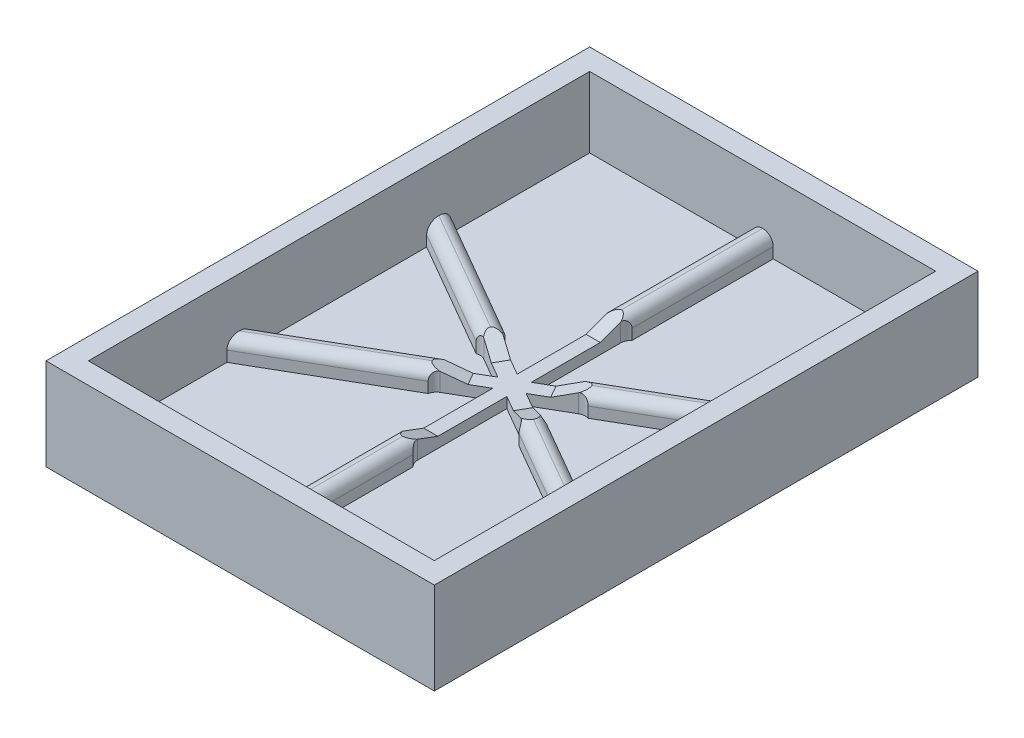
from build123d import *

# Parameters (mm, degrees)
ESQUISSE1_W        = 55
ESQUISSE1_H        = 77
BOSS_EXTRU_1_DEPTH = 3
ESQUISSE2_W        = 55
ESQUISSE2_H        = 77
BOSS_EXTRU_2_DEPTH = 10
BOSS_EXTRU_5_DEPTH = 1.5
BOSS_EXTRU_6_DEPTH = 3
BOSS_EXTRU_7_DEPTH = 2
BOSS_EXTRU_8_DEPTH = 2
BOSS_EXTRU_9_DEPTH = 2
CONG_3_R           = 1.5
CONG_4_R           = 1.5


# Some blends are built 0.0001 mm under size
with BuildPart() as part:
    # Esquisse1 → Boss.-Extru.1 (new body)
    with BuildSketch(Plane(origin=(0, 0, 0), x_dir=(1, 0, 0), z_dir=(0, 1, 0))):
        Rectangle(ESQUISSE1_W, ESQUISSE1_H)
    extrude(amount=BOSS_EXTRU_1_DEPTH)

    # Esquisse2 → Boss.-Extru.2 (add)
    with BuildSketch(Plane(origin=(0, 3, 0), x_dir=(1, 0, 0), z_dir=(0, 1, 0))):
        Rectangle(ESQUISSE2_W, ESQUISSE2_H)
        Polygon((-24.499999999999993, 35.50000000000001), (-24.499999999999982, -35.49999999999999), (24.500000000000007, -35.49999999999999), (24.499999999999993, 35.50000000000001), align=None, mode=Mode.SUBTRACT)
    extrude(amount=BOSS_EXTRU_2_DEPTH)

    # Esquisse3 → Boss.-Extru.5 (add)
    with BuildSketch(Plane(origin=(0, 3, 0), x_dir=(1, 0, 0), z_dir=(0, 1, 0))):
        Polygon((-1.0000000000000002, -35.500000000000014), (-1.000000000000001, -1.7320508075692145), (-25.4807621135329, -15.866025403784949), (-26.480762113533657, -14.133974596214742), (-2.000000000001547, 2.4e-16), (-26.480762113533604, 14.133974596214733), (-25.48076211353285, 15.866025403784942), (-1.0000000000003295, 1.7320508075699388), (-1.0000000000000002, 35.5), (0.9999999999999998, 35.5), (1.0000000000000004, 1.73205080756975), (25.48076211353284, 15.866025403784917), (26.4807621135336, 14.133974596214713), (2.0000000000011395, 2.3766e-13), (26.480762113533643, -14.133974596214754), (25.480762113532894, -15.86602540378496), (1.0000000000000002, -1.732050807569746), (0.9999999999999998, -35.500000000000014), align=None)
    extrude(amount=BOSS_EXTRU_5_DEPTH)

    # Esquisse4 → Boss.-Extru.6 (add)
    with BuildSketch(Plane(origin=(0, 3, 0), x_dir=(1, 0, 0), z_dir=(0, 1, 0))):
        Polygon((-7.929491924311156, -2.8460434894690736), (-26.335106973446237, -13.472530292687704), (-24.835106973446255, -16.070606504041027), (-6.429491924311169, -5.444119700822397), align=None)
        Polygon((1.4999999999999996, 35.50000000000001), (1.5000000000000027, 15.500000000000004), (-1.4999999999999978, 15.500000000000004), (-1.4999999999999996, 35.50000000000001), align=None)
        Polygon((-7.929491924311157, 2.846043489469073), (-6.429491924311172, 5.444119700822394), (-24.835106973446262, 16.070606504041017), (-26.33510697344624, 13.472530292687692), align=None)
        Polygon((7.929491924311156, 2.8460434894690683), (6.429491924311175, 5.44411970082239), (24.835106973446265, 16.070606504041002), (26.335106973446248, 13.47253029268768), align=None)
        Polygon((6.429491924311165, -5.444119700822401), (24.835106973446248, -16.07060650404104), (26.33510697344623, -13.472530292687718), (7.929491924311156, -2.846043489469078), align=None)
        Polygon((1.5000000000000113, -15.500000000000004), (-1.4999999999999891, -15.500000000000004), (-1.4999999999999796, -35.50000000000001), (1.5000000000000195, -35.50000000000001), align=None)
    extrude(amount=BOSS_EXTRU_6_DEPTH)

    # Esquisse5 → Boss.-Extru.7 (add)
    with BuildSketch(Plane(origin=(1.0000000000000004, 0, -2e-17), x_dir=(-2e-17, 0, -1), z_dir=(1, 0, -2e-17))):
        Polygon((15.500000000000004, 4.500000000000001), (15.500000000000004, 6), (11.500000000000004, 4.500000000000001), align=None)
        Polygon((-15.500000000000004, 4.500000000000001), (-15.500000000000004, 6), (-11.500000000000004, 4.500000000000001), align=None)
    extrude(amount=-BOSS_EXTRU_7_DEPTH)

    # Esquisse6 → Boss.-Extru.8 (add)
    with BuildSketch(Plane(origin=(0.5000000000003775, 0, -0.8660254037851042), x_dir=(-0.8660254037844415, 0, -0.4999999999999951), z_dir=(0.4999999999999951, 0, -0.8660254037844415))):
        Polygon((8.29016319029156, 4.500000000000001), (8.29016319029156, 6), (4.29016319029156, 4.500000000000001), align=None)
        Polygon((-8.290163190291564, 4.500000000000001), (-8.290163190291564, 6), (-4.290163190291564, 4.500000000000001), align=None)
    extrude(amount=-BOSS_EXTRU_8_DEPTH)

    # Esquisse7 → Boss.-Extru.9 (add)
    with BuildSketch(Plane(origin=(-0.5000000000003755, 0, -0.8660254037851022), x_dir=(-0.8660254037844419, 0, 0.4999999999999942), z_dir=(-0.4999999999999943, 0, -0.866025403784442))):
        Polygon((8.29016319029156, 4.500000000000001), (8.29016319029156, 6), (4.29016319029156, 4.500000000000001), align=None)
        Polygon((-8.290163190291565, 4.500000000000001), (-8.290163190291565, 6), (-4.290163190291565, 4.500000000000001), align=None)
    extrude(amount=-BOSS_EXTRU_9_DEPTH)

    # Congé3
    # the kernel refuses this fillet: 1.5 mm, written as the material it adds along each edge
    with BuildSketch(Plane(origin=(7.679491924311542, 0.20491502812697915, 3.279056191360634), x_dir=(-0.8660254037844417, 0, -0.4999999999999947), z_dir=(3e-16, 1, 1.04e-15))) as cong_3_piece_1_section:
        with BuildLine():
            CenterArc((1.1180339887492077, -1.5), CONG_3_R, 90, 48.189685104182075)
            Line((-1.03e-15, -0.49999999999923256), (-0.02236067977498537, -0.47999999999921733))
            ThreePointArc((-0.02236067977498537, -0.47999999999921733), (-0.02999999999999965, -0.2499999999996152), (-0.02999999999999979, 4.5e-16))
            Line((-0.02999999999999979, 4.5e-16), (-1.6e-16, 0.02999999999999995))
            Line((-1.6e-16, 0.02999999999999995), (1.1180339887492075, 0.02999999999999995))
            Line((1.1180339887492075, 0.02999999999999995), (1.1180339887492077, -2e-17))
        make_face()
    cong_3_piece_1 = extrude(amount=5.79508497187302, mode=Mode.PRIVATE)
    cong_3_piece_1 = split(cong_3_piece_1, bisect_by=Plane(origin=(6.26635238214522, 5.3609166378917985, 2.318241078666916), z_dir=(0.30408182027976954, -0.9363291775690448, 0.17556172079419408)), keep=Keep.TOP, mode=Mode.PRIVATE)
    add(cong_3_piece_1)
    with BuildSketch(Plane(origin=(6.679491924310785, 0.20491502812694629, 5.011106998930838), x_dir=(-0.8660254037844417, 1.8491723322253147e-15, -0.49999999999999484), z_dir=(2.558e-13, 1, -4.3935e-13))) as cong_3_piece_2_section:
        with BuildLine():
            CenterArc((1.1180339887492197, 1.5000000000000004), CONG_3_R, 221.81031489581747, 48.1896851041825)
            Line((3.04e-15, 0.4999999999992415), (-0.02236067977498087, 0.47999999999922616))
            ThreePointArc((-0.02236067977498087, 0.47999999999922616), (-0.02999999999999789, 0.24999999999962141), (-0.02999999999999957, 6e-17))
            Line((-0.02999999999999957, 6e-17), (-6e-17, -0.02999999999999957))
            Line((-6e-17, -0.02999999999999957), (1.118033988749219, -0.02999999999999961))
            Line((1.118033988749219, -0.02999999999999961), (1.1180339887492192, -3e-17))
        make_face()
    cong_3_piece_2 = extrude(amount=5.795084971873054, mode=Mode.PRIVATE)
    cong_3_piece_2 = split(cong_3_piece_2, bisect_by=Plane(origin=(5.140831857295212, 5.360916637891802, 4.267699812668763), z_dir=(0.30408182027976954, -0.9363291775690448, 0.17556172079419408)), keep=Keep.TOP, mode=Mode.PRIVATE)
    add(cong_3_piece_2)
    with BuildSketch(Plane(origin=(6.679491924310787, 0.2049150281269747, -5.011106998930838), x_dir=(-0.8660254037844415, 2.4159205118947413e-15, 0.49999999999999484), z_dir=(2.96e-15, 1, 3e-16))) as cong_3_piece_3_section:
        with BuildLine():
            CenterArc((1.118033988749203, -1.5), CONG_3_R, 89.99999999999994, 48.18968510418185)
            Line((-1.5e-16, -0.4999999999992273), (-0.02236067977498403, -0.47999999999921195))
            ThreePointArc((-0.02236067977498403, -0.47999999999921195), (-0.0299999999999991, -0.24999999999961453), (-0.02999999999999956, -6e-17))
            Line((-0.02999999999999956, -6e-17), (-6e-17, 0.02999999999999956))
            Line((-6e-17, 0.02999999999999956), (1.1180339887492046, 0.02999999999999955))
            Line((1.1180339887492046, 0.02999999999999955), (1.1180339887492046, -3e-17))
        make_face()
    cong_3_piece_3 = extrude(amount=5.795084971873026, mode=Mode.PRIVATE)
    cong_3_piece_3 = split(cong_3_piece_3, bisect_by=Plane(origin=(5.140831857294852, 5.360916637891798, -4.26769981266937), z_dir=(0.30408182027976965, -0.9363291775690445, -0.17556172079419374)), keep=Keep.TOP, mode=Mode.PRIVATE)
    add(cong_3_piece_3)
    with BuildSketch(Plane(origin=(7.679491924311382, 0.20491502812626994, -3.279056191360903), x_dir=(0.49999999999999595, 4.028111296295061e-13, 0.866025403784441), z_dir=(-1.9925e-13, 1, -3.5009e-13))) as cong_3_piece_4_section:
        with BuildLine():
            CenterArc((1.4999999999999813, -1.1180339887495117), CONG_3_R, 131.81031489580056, 48.18968510419856)
            Line((-1.912e-14, -1.118033988749488), (-0.03000000000001908, -1.1180339887494877))
            Line((-0.03000000000001908, -1.1180339887494877), (-0.02999999999999995, 2e-16))
            Line((-0.02999999999999995, 2e-16), (-2e-17, 0.02999999999999957))
            ThreePointArc((-2e-17, 0.02999999999999957), (0.24999999999977643, 0.02999999999999957), (0.479999999999544, 0.02236067977498998))
            Line((0.479999999999544, 0.02236067977498998), (0.4999999999995529, 1e-17))
        make_face()
    cong_3_piece_4 = extrude(amount=5.79508497187373, mode=Mode.PRIVATE)
    cong_3_piece_4 = split(cong_3_piece_4, bisect_by=Plane(origin=(6.26635238214469, 5.360916637891739, -2.3182410786675236), z_dir=(0.30408182027976965, -0.9363291775690445, -0.17556172079419374)), keep=Keep.TOP, mode=Mode.PRIVATE)
    add(cong_3_piece_4)
    with BuildSketch(Plane(origin=(-1.0000000000001952, 0.2049150281256935, -15.500000000000004), x_dir=(-9.73e-15, 0, 1), z_dir=(6.517e-14, 1, 0))) as cong_3_piece_5_section:
        with BuildLine():
            CenterArc((1.118033988749723, -1.5), CONG_3_R, 90.00000000000003, 48.189685104211264)
            Line((4.87e-15, -0.4999999999998024), (-0.02236067977498978, -0.47999999999979837))
            ThreePointArc((-0.02236067977498978, -0.47999999999979837), (-0.02999999999999693, -0.2499999999999015), (-0.02999999999999936, -2.9e-16))
            Line((-0.02999999999999936, -2.9e-16), (-2.9e-16, 0.03000000000000003))
            Line((-2.9e-16, 0.03000000000000003), (1.1180339887497224, 0.03000000000000003))
            Line((1.1180339887497224, 0.03000000000000003), (1.1180339887497226, 0))
        make_face()
    cong_3_piece_5 = extrude(amount=5.7950849718743065, mode=Mode.PRIVATE)
    cong_3_piece_5 = split(cong_3_piece_5, bisect_by=Plane(origin=(-1.1255205248498867, 5.36091663789169, -13.79577770104451), z_dir=(0, -0.9363291775690445, -0.35112344158839154)), keep=Keep.TOP, mode=Mode.PRIVATE)
    add(cong_3_piece_5)
    with BuildSketch(Plane(origin=(1.0000000000000002, 0.2049150281252583, -15.500000000000004), x_dir=(-2e-16, 0, 1), z_dir=(0, 1, 0))) as cong_3_piece_6_section:
        with BuildLine():
            CenterArc((1.1180339887498965, 1.5), CONG_3_R, 221.81031489577848, 48.18968510422155)
            Line((-1e-16, 0.5000000000000022), (-0.0223606797749981, 0.4800000000000022))
            ThreePointArc((-0.0223606797749981, 0.4800000000000022), (-0.02999999999999941, 0.2500000000000011), (-0.02999999999999936, -1e-17))
            Line((-0.02999999999999936, -1e-17), (1e-17, -0.03000000000000003))
            Line((1e-17, -0.03000000000000003), (1.1180339887498967, -0.03000000000000003))
            Line((1.1180339887498967, -0.03000000000000003), (1.1180339887498967, 0))
        make_face()
    cong_3_piece_6 = extrude(amount=5.795084971874742, mode=Mode.PRIVATE)
    cong_3_piece_6 = split(cong_3_piece_6, bisect_by=Plane(origin=(1.1255205248498363, 5.360916637891653, -13.795777701044411), z_dir=(0, -0.9363291775690445, -0.35112344158839154)), keep=Keep.TOP, mode=Mode.PRIVATE)
    add(cong_3_piece_6)
    with BuildSketch(Plane(origin=(-7.67949192431154, 0.20491502812696538, -3.2790561913606355), x_dir=(0.8660254037844416, 0, 0.49999999999999506), z_dir=(2.552e-13, 1, -4.4157e-13))) as cong_3_piece_7_section:
        with BuildLine():
            CenterArc((1.1180339887492157, -1.5), CONG_3_R, 90.00000000000003, 48.189685104182416)
            Line((3.9e-16, -0.4999999999992401), (-0.02236067977498396, -0.4799999999992249))
            ThreePointArc((-0.02236067977498396, -0.4799999999992249), (-0.02999999999999911, -0.24999999999961958), (-0.02999999999999957, 6e-17))
            Line((-0.02999999999999957, 6e-17), (-1.7e-16, 0.02999999999999995))
            Line((-1.7e-16, 0.02999999999999995), (1.118033988749215, 0.02999999999999993))
            Line((1.118033988749215, 0.02999999999999993), (1.1180339887492152, 2e-17))
        make_face()
    cong_3_piece_7 = extrude(amount=5.795084971873035, mode=Mode.PRIVATE)
    cong_3_piece_7 = split(cong_3_piece_7, bisect_by=Plane(origin=(-6.266352382144866, 5.360916637891801, -2.318241078667536), z_dir=(-0.30408182027976954, -0.9363291775690448, -0.17556172079419408)), keep=Keep.TOP, mode=Mode.PRIVATE)
    add(cong_3_piece_7)
    with BuildSketch(Plane(origin=(-6.679491924310783, 0.20491502812699558, -5.011106998930843), x_dir=(0.49999999999999273, 0, -0.8660254037844428), z_dir=(-5.9e-16, 1, -3e-16))) as cong_3_piece_8_section:
        with BuildLine():
            CenterArc((1.4999999999999964, -1.1180339887492052), CONG_3_R, 131.8103148958181, 48.18968510418176)
            Line((-3.77e-15, -1.1180339887492012), (-0.03000000000000333, -1.118033988749201))
            Line((-0.03000000000000333, -1.118033988749201), (-0.02999999999999956, 1.3e-16))
            Line((-0.02999999999999956, 1.3e-16), (1.3e-16, 0.02999999999999957))
            ThreePointArc((1.3e-16, 0.02999999999999957), (0.2499999999996134, 0.0299999999999988), (0.4799999999992104, 0.02236067977498394))
            Line((0.4799999999992104, 0.02236067977498394), (0.4999999999992257, 2e-17))
        make_face()
    cong_3_piece_8 = extrude(amount=5.795084971873004, mode=Mode.PRIVATE)
    cong_3_piece_8 = split(cong_3_piece_8, bisect_by=Plane(origin=(-5.140831857294851, 5.3609166378918, -4.267699812669376), z_dir=(-0.30408182027976954, -0.9363291775690448, -0.17556172079419408)), keep=Keep.TOP, mode=Mode.PRIVATE)
    add(cong_3_piece_8)
    with BuildSketch(Plane(origin=(1, 0.2049150281252361, 15.500000000000004), x_dir=(0, 0, -1), z_dir=(2.2e-16, 1, 0))) as cong_3_piece_9_section:
        with BuildLine():
            CenterArc((1.1180339887499056, -1.5), CONG_3_R, 90, 48.18968510422201)
            Line((0, -0.5000000000000115), (-0.022360679774998, -0.48000000000001175))
            ThreePointArc((-0.022360679774998, -0.48000000000001175), (-0.02999999999999936, -0.2500000000000058), (-0.02999999999999936, 0))
            Line((-0.02999999999999936, 0), (0, 0.03000000000000003))
            Line((0, 0.03000000000000003), (1.1180339887499056, 0.03000000000000003))
            Line((1.1180339887499056, 0.03000000000000003), (1.1180339887499056, 0))
        make_face()
    cong_3_piece_9 = extrude(amount=5.795084971874764, mode=Mode.PRIVATE)
    cong_3_piece_9 = split(cong_3_piece_9, bisect_by=Plane(origin=(1.1255205248498388, 5.360916637891652, 13.795777701044408), z_dir=(0, -0.9363291775690445, 0.35112344158839154)), keep=Keep.TOP, mode=Mode.PRIVATE)
    add(cong_3_piece_9)
    with BuildSketch(Plane(origin=(-1.0000000000000007, 0.20491502812529383, 15.500000000000004), x_dir=(-2e-16, 0, -1), z_dir=(4.8e-16, 1, 0))) as cong_3_piece_10_section:
        with BuildLine():
            CenterArc((1.1180339887498827, 1.5), CONG_3_R, 221.81031489577921, 48.18968510422076)
            Line((-1.68e-15, 0.49999999999998757), (-0.02236067977499969, 0.4799999999999873))
            ThreePointArc((-0.02236067977499969, 0.4799999999999873), (-0.02999999999999931, 0.24999999999999378), (-0.02999999999999936, 1e-17))
            Line((-0.02999999999999936, 1e-17), (-1e-17, -0.03000000000000003))
            Line((-1e-17, -0.03000000000000003), (1.1180339887498825, -0.03000000000000003))
            Line((1.1180339887498825, -0.03000000000000003), (1.1180339887498825, 0))
        make_face()
    cong_3_piece_10 = extrude(amount=5.795084971874706, mode=Mode.PRIVATE)
    cong_3_piece_10 = split(cong_3_piece_10, bisect_by=Plane(origin=(-1.1255205248498321, 5.360916637891656, 13.79577770104442), z_dir=(0, -0.9363291775690445, 0.35112344158839154)), keep=Keep.TOP, mode=Mode.PRIVATE)
    add(cong_3_piece_10)
    with BuildSketch(Plane(origin=(-6.679491924310963, 0.20491502812617934, 5.011106998930529), x_dir=(0.8660254037844338, 1.4527323097483483e-15, -0.5000000000000083), z_dir=(-1.9688e-13, 1, -3.381e-13))) as cong_3_piece_11_section:
        with BuildLine():
            CenterArc((1.1180339887495254, -1.4999999999999998), CONG_3_R, 90.00000000000006, 48.18968510420052)
            Line((-6.02e-15, -0.49999999999959355), (-0.02236067977499678, -0.479999999999585))
            ThreePointArc((-0.02236067977499678, -0.479999999999585), (-0.0300000000000028, -0.24999999999979675), (-0.02999999999999956, 4.1e-16))
            Line((-0.02999999999999956, 4.1e-16), (-3.6e-16, 0.03000000000000001))
            Line((-3.6e-16, 0.03000000000000001), (1.118033988749524, 0.03000000000000005))
            Line((1.118033988749524, 0.03000000000000005), (1.1180339887495243, 5e-17))
        make_face()
    cong_3_piece_11 = extrude(amount=5.795084971873821, mode=Mode.PRIVATE)
    cong_3_piece_11 = split(cong_3_piece_11, bisect_by=Plane(origin=(-5.140831857295105, 5.360916637891735, 4.267699812668589), z_dir=(-0.30408182027976965, -0.9363291775690445, 0.17556172079419374)), keep=Keep.TOP, mode=Mode.PRIVATE)
    add(cong_3_piece_11)
    with BuildSketch(Plane(origin=(-7.679491924311542, 0.20491502812697604, 3.279056191360633), x_dir=(0.8660254037844413, 0, -0.4999999999999951), z_dir=(-8.9e-16, 1, 1.5e-16))) as cong_3_piece_12_section:
        with BuildLine():
            CenterArc((1.1180339887492128, 1.4999999999999998), CONG_3_R, 221.81031489581775, 48.18968510418216)
            Line((1.24e-15, 0.49999999999923594), (-0.02236067977498311, 0.4799999999992207))
            ThreePointArc((-0.02236067977498311, 0.4799999999992207), (-0.02999999999999849, 0.2499999999996187), (-0.02999999999999956, -5e-17))
            Line((-0.02999999999999956, -5e-17), (-1.7e-16, -0.02999999999999994))
            Line((-1.7e-16, -0.02999999999999994), (1.1180339887492108, -0.02999999999999993))
            Line((1.1180339887492108, -0.02999999999999993), (1.118033988749211, -2e-17))
        make_face()
    cong_3_piece_12 = extrude(amount=5.795084971873024, mode=Mode.PRIVATE)
    cong_3_piece_12 = split(cong_3_piece_12, bisect_by=Plane(origin=(-6.26635238214522, 5.3609166378917985, 2.3182410786669125), z_dir=(-0.30408182027976965, -0.9363291775690445, 0.17556172079419374)), keep=Keep.TOP, mode=Mode.PRIVATE)
    add(cong_3_piece_12)

    # Congé4
    cong_4_edges = [part.edges().sort_by_distance(p)[0] for p in [
        (-1.4999999999999987, 6, -25.500000000000007),
        (1.500000000000001, 6, -25.500000000000007),
        (15.464745962155586, 6, -10.660626051768435),
        (16.214745962155575, 6, -7.629537138522904),
        (16.214745962155583, 6, 7.629537138522935),
        (15.464745962155583, 6, 10.660626051768467),
        (1.5000000000000155, 6, 25.500000000000007),
        (-1.4999999999999845, 6, 25.500000000000007),
        (-15.464745962155579, 6, 10.660626051768453),
        (-16.214745962155572, 6, 7.62953713852292),
        (-16.214745962155575, 6, -7.629537138522914),
        (-15.46474596215558, 6, -10.660626051768443),
    ]]
    fillet(cong_4_edges, radius=CONG_4_R - 0.0001)  # a hair under: the kernel refuses the full size


solid = part.part
